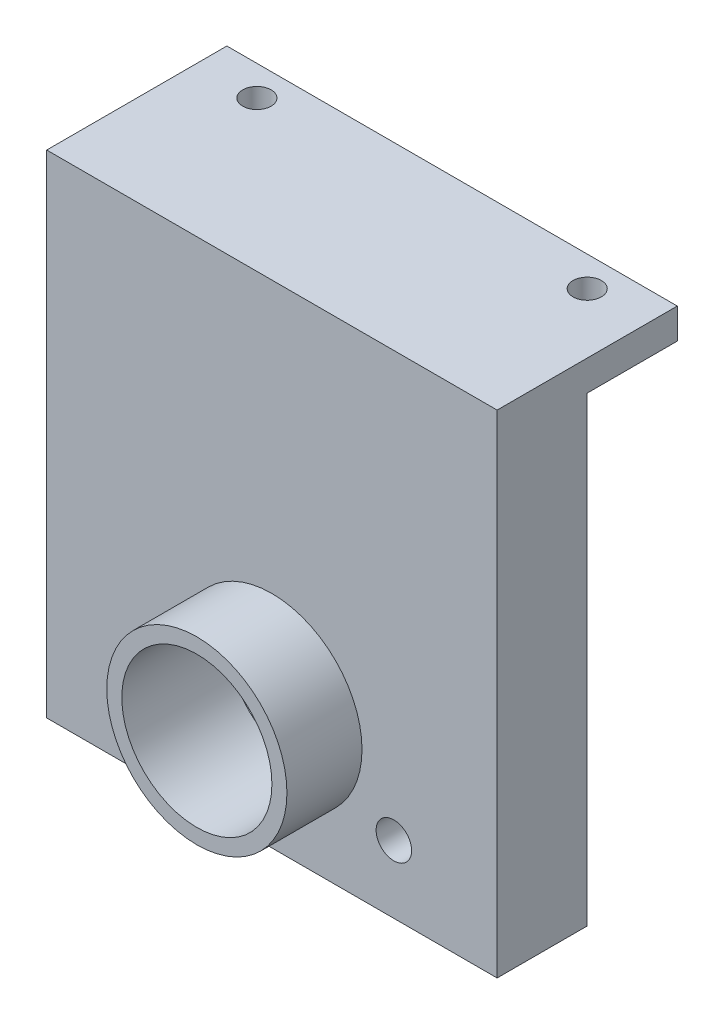
from build123d import *

# Parameters (mm, degrees)
SKETCH2_W               = 38.1
SKETCH2_H               = 41.6052
SKETCH2_W_2             = 33.02
SKETCH2_H_2             = 33.9852
BOSS_EXTRUDE1_DEPTH     = 5.08
BOSS_EXTRUDE2_DEPTH     = 7.62
M2_CLEARANCE_HOLE1_D    = 2.4
SKETCH8_W               = 38.1
SKETCH8_H               = 41.6052
SKETCH8_R               = 6.35
BOSS_EXTRUDE3_DEPTH     = 2.54
CUT_EXTRUDE1_DEPTH      = 48.488789909
CUT_EXTRUDE1_DEPTH_BACK = 48.488789909
SKETCH7_R               = 1.50114
SKETCH9_R               = 7.62
SKETCH9_R_2             = 6.35
BOSS_EXTRUDE4_DEPTH     = 6.35


with BuildPart() as part:
    # Sketch2 → Boss-Extrude1 (new body)
    with BuildSketch(Plane.XY):
        with Locations((0, 20.8026)):
            Rectangle(SKETCH2_W, SKETCH2_H)
        with Locations((0, 19.5326)):
            Rectangle(SKETCH2_W_2, SKETCH2_H_2, mode=Mode.SUBTRACT)
    extrude(amount=BOSS_EXTRUDE1_DEPTH)

    # Sketch4 → Boss-Extrude2 (add)
    with BuildSketch(Plane(origin=(0, 0, 0), x_dir=(-1, 0, 0), z_dir=(0, 0, -1))):
        Polygon((-19.05, 41.6052), (19.05, 41.6052), (19.05, 39.0652), (-19.05, 39.036199263), align=None)
    extrude(amount=BOSS_EXTRUDE2_DEPTH)

    # M2 Clearance Hole1 (through all)
    with Locations(Plane(origin=(0, 41.6052, 0), x_dir=(1, 0, 0), z_dir=(0, 1, 0))):
        with Locations((-13.97, 5.08), (13.97, 5.08)):
            Hole(M2_CLEARANCE_HOLE1_D / 2)

    # Sketch8 → Boss-Extrude3 (add)
    with BuildSketch(Plane.XY.offset(5.08)):
        with Locations((0, 20.8026)):
            Rectangle(SKETCH8_W, SKETCH8_H)
        with Locations((0, 11.02614)):
            Circle(SKETCH8_R, mode=Mode.SUBTRACT)
    extrude(amount=BOSS_EXTRUDE3_DEPTH)

    # Sketch7 → Cut-Extrude1 (cut, two sides: drawn at the far end of the back side and taken through both)
    with BuildSketch(Plane.XY.offset(5.08).offset(-CUT_EXTRUDE1_DEPTH_BACK)):
        with Locations((-10.31494, 5.715)):
            Circle(SKETCH7_R)
        with Locations((10.31494, 5.715)):
            Circle(SKETCH7_R)
    extrude(amount=CUT_EXTRUDE1_DEPTH + CUT_EXTRUDE1_DEPTH_BACK, mode=Mode.SUBTRACT)

    # Sketch9 → Boss-Extrude4 (add)
    with BuildSketch(Plane.XY.offset(7.62)):
        with Locations((0, 11.02614)):
            Circle(SKETCH9_R)
        with Locations((0, 11.02614)):
            Circle(SKETCH9_R_2, mode=Mode.SUBTRACT)
    extrude(amount=BOSS_EXTRUDE4_DEPTH)


solid = part.part
